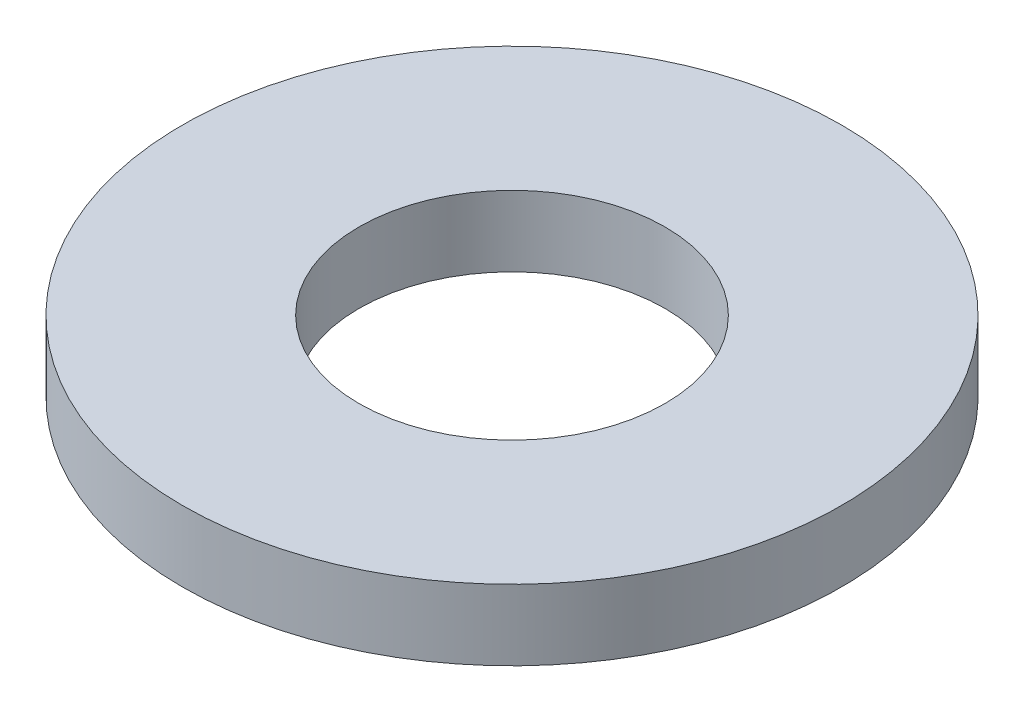
from build123d import *

# Parameters (mm, degrees)
SKETCH1_R           = 70
BOSS_EXTRUDE1_DEPTH = 15
SKETCH2_R           = 32.5
CUT_EXTRUDE1_DEPTH  = 101.124921973


with BuildPart() as part:
    # Sketch1 → Boss-Extrude1 (new body)
    with BuildSketch(Plane(origin=(0, 0, 0), x_dir=(1, 0, 0), z_dir=(0, 1, 0))):
        Circle(SKETCH1_R)
    extrude(amount=BOSS_EXTRUDE1_DEPTH)

    # Sketch2 → Cut-Extrude1 (cut, through all)
    with BuildSketch(Plane(origin=(0, 0, 0), x_dir=(1, 0, 0), z_dir=(0, 1, 0))):
        Circle(SKETCH2_R)
    extrude(amount=CUT_EXTRUDE1_DEPTH, mode=Mode.SUBTRACT)


solid = part.part
